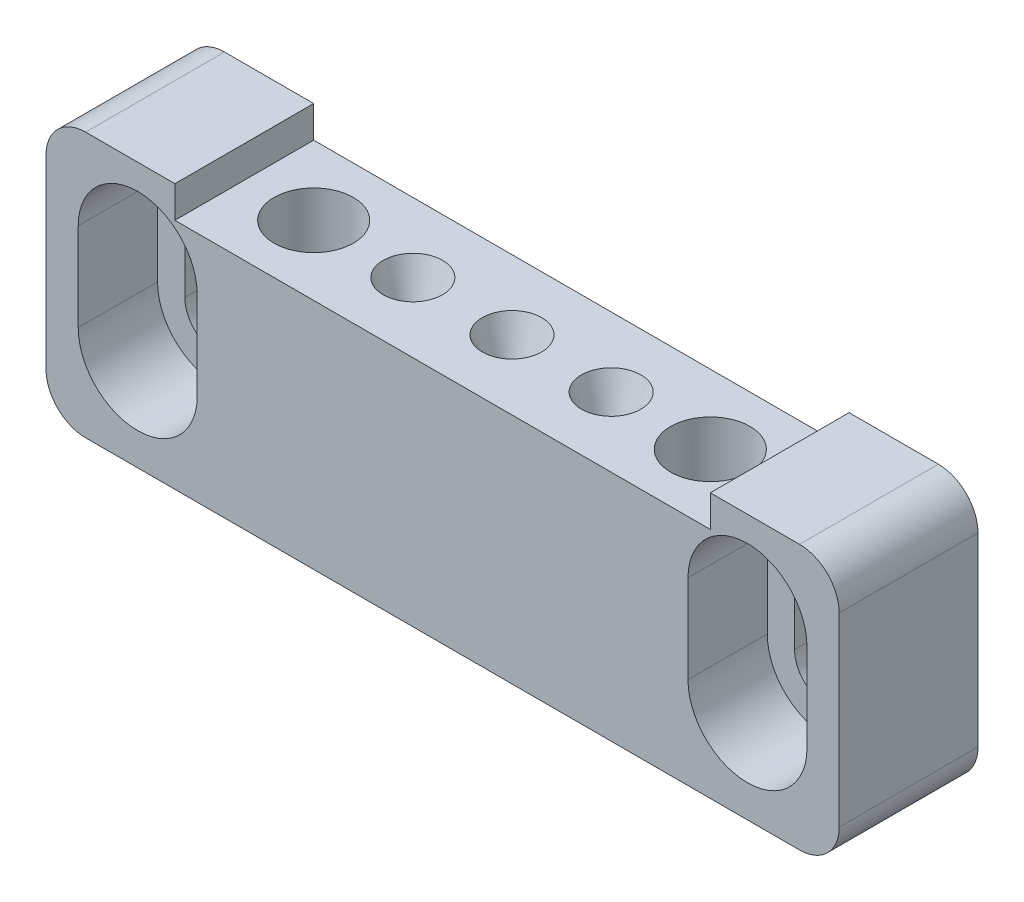
from build123d import *

# Parameters (mm, degrees)
BOSS_EXTRUDE1_DEPTH          = 7
CUT_EXTRUDE1_DEPTH           = 4
CUT_EXTRUDE4_DEPTH           = 30.03484975
SKETCH8_R                    = 2
CUT_EXTRUDE5_DEPTH           = 18
SKETCH9_R                    = 3
CUT_EXTRUDE6_DEPTH           = 8.1
SKETCH10_W                   = 40
SKETCH10_H                   = 6.5
CUT_EXTRUDE7_DEPTH           = 30.034849842
FILLET1_R                    = 2
SKETCH11_R                   = 1.5
CUT_EXTRUDE8_DEPTH           = 3
CUT_EXTRUDE8_DRAFT           = -20
CUT_EXTRUDE8_PROFILE_2_DEPTH = 3
CUT_EXTRUDE8_PROFILE_2_DRAFT = -20
CUT_EXTRUDE8_PROFILE_3_DEPTH = 3
CUT_EXTRUDE8_PROFILE_3_DRAFT = -20


with BuildPart() as part:
    # Sketch1 → Boss-Extrude1 (new body)
    with BuildSketch(Plane.XY):
        with BuildLine():
            Line((0, 0), (18, 0))
            ThreePointArc((18, 0), (19.414213562, 0.585786438), (20, 2))
            Line((20, 2), (20, 11.945768163))
            ThreePointArc((20, 11.945768163), (19.769252649, 12.878369398), (19.130254936, 13.595775369))
            Line((19.130254936, 13.595775369), (10.510938386, 19.500007206))
            ThreePointArc((10.510938386, 19.500007206), (9.972285338, 19.760499203), (9.380683449, 19.85))
            Line((9.380683449, 19.85), (-9.380683449, 19.85))
            ThreePointArc((-9.380683449, 19.85), (-9.972285338, 19.760499203), (-10.510938386, 19.500007206))
            Line((-10.510938386, 19.500007206), (-19.130254936, 13.595775369))
            ThreePointArc((-19.130254936, 13.595775369), (-19.769252649, 12.878369398), (-20, 11.945768163))
            Line((-20, 11.945768163), (-20, 2))
            ThreePointArc((-20, 2), (-19.414213562, 0.585786438), (-18, 0))
            Line((-18, 0), (0, 0))
        make_face()
        with BuildLine():
            Line((-13.75, 9.075), (-13.75, 4.625))
            ThreePointArc((-13.75, 4.625), (-15.375, 3), (-17, 4.625))
            Line((-17, 4.625), (-17, 9.075))
            ThreePointArc((-17, 9.075), (-15.375, 10.7), (-13.75, 9.075))
        make_face(mode=Mode.SUBTRACT)
        with BuildLine():
            Line((17, 9.075), (17, 4.625))
            ThreePointArc((17, 4.625), (15.375, 3), (13.75, 4.625))
            Line((13.75, 4.625), (13.75, 9.075))
            ThreePointArc((13.75, 9.075), (15.375, 10.7), (17, 9.075))
        make_face(mode=Mode.SUBTRACT)
    extrude(amount=BOSS_EXTRUDE1_DEPTH)

    # Sketch2 → Cut-Extrude1 (cut)
    with BuildSketch(Plane.XY.offset(7)):
        with BuildLine():
            Line((-18.375, 4.625), (-18.375, 9.075))
            ThreePointArc((-18.375, 9.075), (-15.375, 12.075), (-12.375, 9.075))
            Line((-12.375, 9.075), (-12.375, 4.625))
            ThreePointArc((-12.375, 4.625), (-15.375, 1.625), (-18.375, 4.625))
        make_face()
        with BuildLine():
            Line((12.375, 4.625), (12.375, 9.075))
            ThreePointArc((12.375, 9.075), (15.375, 12.075), (18.375, 9.075))
            Line((18.375, 9.075), (18.375, 4.625))
            ThreePointArc((18.375, 4.625), (15.375, 1.625), (12.375, 4.625))
        make_face()
    extrude(amount=-CUT_EXTRUDE1_DEPTH, mode=Mode.SUBTRACT)

    # Sketch6 → Cut-Extrude4 (cut, through all)
    with BuildSketch(Plane.XY.offset(7)):
        Polygon((-13.5, 13.35), (-6.5, 13.35), (-6.5, 19.85), (6.5, 19.85), (6.5, 13.35), (13.5, 13.35), (13.5, 11.75), (-13.5, 11.75), align=None)
    extrude(amount=-CUT_EXTRUDE4_DEPTH, mode=Mode.SUBTRACT)

    # Sketch8 → Cut-Extrude5 (cut)
    with BuildSketch(Plane(origin=(0, 19.85, 0), x_dir=(1, 0, 0), z_dir=(0, 1, 0))):
        with Locations(Location((-10, -3.5, 0), (0, 0, 180))):
            Circle(SKETCH8_R)
        with Locations(Location((10, -3.5, 0), (0, 0, 180))):
            Circle(SKETCH8_R)
    extrude(amount=-CUT_EXTRUDE5_DEPTH, mode=Mode.SUBTRACT)

    # Sketch9 → Cut-Extrude6 (cut)
    with BuildSketch(Plane(origin=(0, 19.85, 0), x_dir=(1, 0, 0), z_dir=(0, 1, 0))):
        with Locations(Location((10, -3.5, 0), (0, 0, 101.913740948))):
            Circle(SKETCH9_R)
        with Locations(Location((-10, -3.5, 0), (0, 0, 99.806006121))):
            Circle(SKETCH9_R)
    extrude(amount=-CUT_EXTRUDE6_DEPTH, mode=Mode.SUBTRACT)

    # Sketch10 → Cut-Extrude7 (cut, through all)
    with BuildSketch(Plane.XY.offset(7)):
        with Locations((0, 16.6)):
            Rectangle(SKETCH10_W, SKETCH10_H)
    extrude(amount=-CUT_EXTRUDE7_DEPTH, mode=Mode.SUBTRACT)

    # Fillet1
    # the kernel refuses this fillet: 2 mm, written as the material it takes off along each edge
    with BuildSketch(Plane(origin=(-19.424125327, 13.35, 12.203143064), x_dir=(-0.27669557885699486, -0.9609576247894558, 0), z_dir=(0, 0, -1))) as fillet1_piece_1:
        with BuildLine():
            CenterArc((1.527866068, -1.92191525), FILLET1_R, 73.936914891, 90)
            Line((-0.394049182, -1.368524092), (-0.586240707, -1.313184976))
            Line((-0.586240707, -1.313184976), (-0.192191525, 0.055339116))
            Line((-0.192191525, 0.055339116), (-0.095535811, 0.175706883))
            ThreePointArc((-0.095535811, 0.175706883), (1.564088383, 0.357037942), (2.136596341, 0.192191525))
            Line((2.136596341, 0.192191525), (2.081257226, 0))
        make_face()
    extrude(amount=17.406286128, mode=Mode.SUBTRACT)
    with BuildSketch(Plane(origin=(19.424125327, 13.35, 12.203143064), x_dir=(-1, 0, 0), z_dir=(0, 0, -1))) as fillet1_piece_2:
        with BuildLine():
            CenterArc((1.424125327, -2), FILLET1_R, 90, 90)
            Line((-0.575874673, -2), (-0.775874673, -2))
            ThreePointArc((-0.775874673, -2), (-0.775874673, -1.404231837), (-0.142412533, 0.140423184))
            Line((-0.142412533, 0.140423184), (0, 0.2))
            Line((0, 0.2), (1.424125327, 0.2))
            Line((1.424125327, 0.2), (1.424125327, 0))
        make_face()
    extrude(amount=17.406286128, mode=Mode.SUBTRACT)


with BuildPart() as cut_extrude8_tool:
    # Sketch11 → Cut-Extrude8 (with draft: the straight prism first)
    with BuildSketch(Plane(origin=(0, 11.75, 0), x_dir=(1, 0, 0), z_dir=(0, 1, 0))):
        with Locations((0, -3.5)):
            Circle(SKETCH11_R)
    extrude(amount=-CUT_EXTRUDE8_DEPTH)
    # Cut-Extrude8: the draft: its side faces are tilted about the plane it starts from
    cut_extrude8_sides = [cut_extrude8_tool.faces().sort_by_distance(p)[0] for p in [
        (-1.5, 10.25, 3.5),
    ]]
    draft(cut_extrude8_sides, Plane(origin=(0, 11.75, 0), x_dir=(1, 0, 0), z_dir=(0, 1, 0)), CUT_EXTRUDE8_DRAFT)


with BuildPart() as part_1:
    add(part.part)

    # Cut-Extrude8: cut by cut_extrude8_tool
    add(cut_extrude8_tool.part, mode=Mode.SUBTRACT)


with BuildPart() as cut_extrude8_profile_2_tool:
    # Sketch11 → Cut-Extrude8 profile 2 (with draft: the straight prism first)
    with BuildSketch(Plane(origin=(0, 11.75, 0), x_dir=(1, 0, 0), z_dir=(0, 1, 0))):
        with Locations((5, -3.5)):
            Circle(SKETCH11_R)
    extrude(amount=-CUT_EXTRUDE8_PROFILE_2_DEPTH)
    # Cut-Extrude8 profile 2: the draft: its side faces are tilted about the plane it starts from
    cut_extrude8_profile_2_sides = [cut_extrude8_profile_2_tool.faces().sort_by_distance(p)[0] for p in [
        (3.5, 10.25, 3.5),
    ]]
    draft(cut_extrude8_profile_2_sides, Plane(origin=(0, 11.75, 0), x_dir=(1, 0, 0), z_dir=(0, 1, 0)), CUT_EXTRUDE8_PROFILE_2_DRAFT)


with BuildPart() as part_2:
    add(part_1.part)

    # Cut-Extrude8 profile 2: cut by cut_extrude8_profile_2_tool
    add(cut_extrude8_profile_2_tool.part, mode=Mode.SUBTRACT)


with BuildPart() as cut_extrude8_profile_3_tool:
    # Sketch11 → Cut-Extrude8 profile 3 (with draft: the straight prism first)
    with BuildSketch(Plane(origin=(0, 11.75, 0), x_dir=(1, 0, 0), z_dir=(0, 1, 0))):
        with Locations((-5, -3.5)):
            Circle(SKETCH11_R)
    extrude(amount=-CUT_EXTRUDE8_PROFILE_3_DEPTH)
    # Cut-Extrude8 profile 3: the draft: its side faces are tilted about the plane it starts from
    cut_extrude8_profile_3_sides = [cut_extrude8_profile_3_tool.faces().sort_by_distance(p)[0] for p in [
        (-6.5, 10.25, 3.5),
    ]]
    draft(cut_extrude8_profile_3_sides, Plane(origin=(0, 11.75, 0), x_dir=(1, 0, 0), z_dir=(0, 1, 0)), CUT_EXTRUDE8_PROFILE_3_DRAFT)


with BuildPart() as part_3:
    add(part_2.part)

    # Cut-Extrude8 profile 3: cut by cut_extrude8_profile_3_tool
    add(cut_extrude8_profile_3_tool.part, mode=Mode.SUBTRACT)


solid = part_3.part
